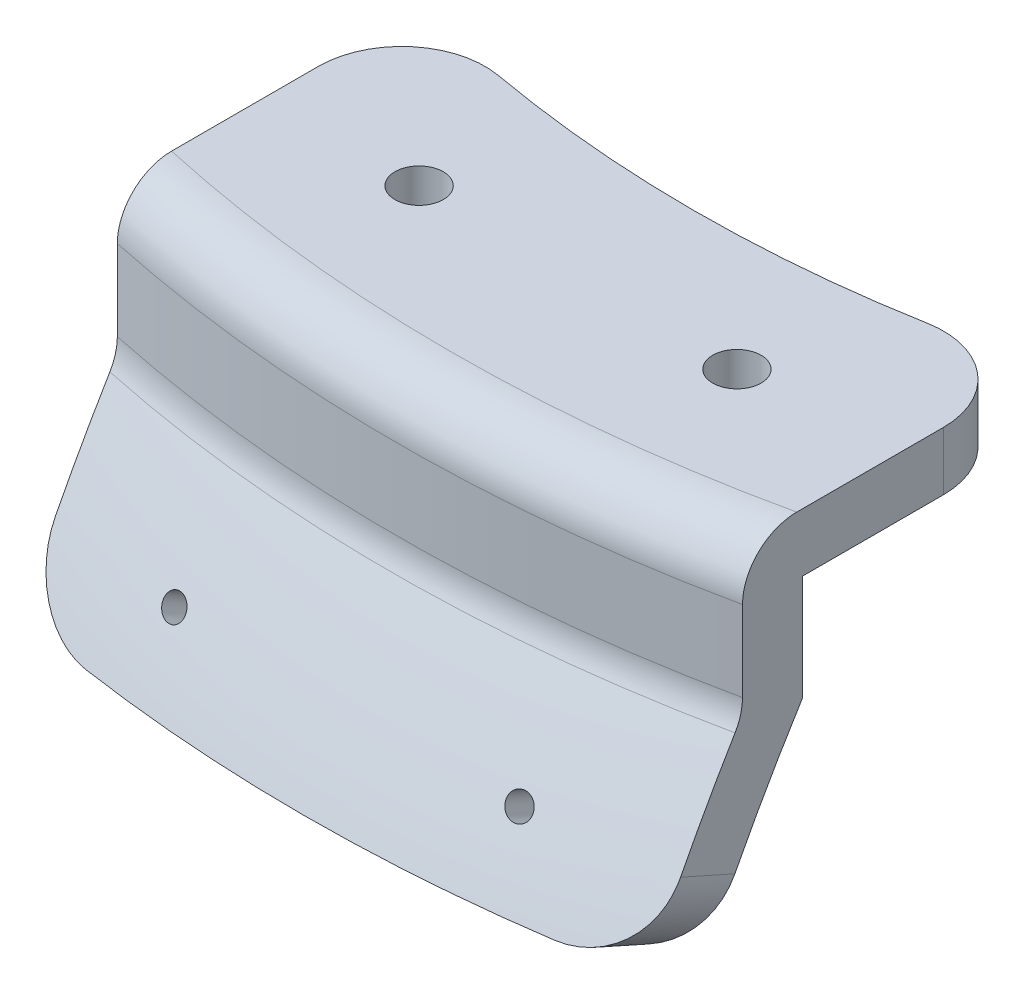
from build123d import *

# Parameters (mm, degrees)
REVOLVE1_ANGLE      = 30
FILLET1_R           = 6.35
SKETCH3_R           = 2.9
CUT_EXTRUDE1_DEPTH  = 203.397131237
SKETCH4_OUTSIDE_W   = 125.116
SKETCH4_OUTSIDE_H   = 77.698
SKETCH4_OUTSIDE_W_2 = 74.947346354
SKETCH4_OUTSIDE_H_2 = 51.780385927
CUT_EXTRUDE2_DEPTH  = 203.397131237
FILLET2_R           = 10


with BuildPart() as part:
    # Sketch2 → Revolve1 (revolve, symmetric)
    with BuildSketch(Plane(origin=(0, 0, 0), x_dir=(0, 0, -1), z_dir=(1, 0, 0))) as revolve1_sk:
        with BuildLine():
            Line((-173.362154908, 178.868849687), (-173.362154908, 166.168849687))
            ThreePointArc((-173.362154908, 166.168849687), (-179.65986055, 155.104357922), (-185.252314728, 143.667202217))
            Line((-185.252314728, 143.667202217), (-191.634038168, 146.54358987))
            ThreePointArc((-191.634038168, 146.54358987), (-186.310738836, 157.495769138), (-180.362154908, 168.121308924))
            Line((-180.362154908, 168.121308924), (-180.362154908, 185.868849687))
            Line((-180.362154908, 185.868849687), (-144.787154908, 185.868849687))
            Line((-144.787154908, 185.868849687), (-144.787154908, 178.868849687))
            Line((-144.787154908, 178.868849687), (-173.362154908, 178.868849687))
        make_face()
    revolve(axis=Axis((0, 60.169777778, 0), (0, 1, 0)), revolution_arc=REVOLVE1_ANGLE / 2)
    revolve(revolve1_sk.sketch, axis=Axis((0, 60.169777778, 0), (0, -1, 0)), revolution_arc=REVOLVE1_ANGLE / 2)

    # Fillet1
    fillet1_edges = [part.edges().sort_by_distance(p)[0] for p in [
        (0, 168.121308924, 180.362154908),
        (0, 185.868849687, 180.362154908),
    ]]
    fillet(fillet1_edges, radius=FILLET1_R)

    # Sketch3 → Cut-Extrude1 (cut, through all)
    with BuildSketch(Plane.XZ.offset(-185.868849687)):
        with Locations((19.05, 158.674245572)):
            Circle(SKETCH3_R)
        with Locations((-19.05, 158.674245572)):
            Circle(SKETCH3_R)
    extrude(amount=CUT_EXTRUDE1_DEPTH, mode=Mode.SUBTRACT)

    # Sketch4 outside → Cut-Extrude2 (cut, through all)
    with BuildSketch(Plane(origin=(0, 185.868849687, 0), x_dir=(1, 0, 0), z_dir=(0, 1, 0))):
        with Locations((0, -165.744)):
            Rectangle(SKETCH4_OUTSIDE_W, SKETCH4_OUTSIDE_H)
        with Locations((0, -165.743845205)):
            Rectangle(SKETCH4_OUTSIDE_W_2, SKETCH4_OUTSIDE_H_2, mode=Mode.SUBTRACT)
    extrude(amount=-CUT_EXTRUDE2_DEPTH, mode=Mode.SUBTRACT)

    # Fillet2
    fillet2_edges = [part.edges().sort_by_distance(p)[0] for p in [
        (-37.473673177, 145.104976424, 184.678649796),
        (-37.473673177, 182.368849687, 139.853652241),
        (37.473673177, 182.368849687, 139.853652241),
        (37.473673177, 145.104976424, 184.678649796),
    ]]
    fillet(fillet2_edges, radius=FILLET2_R)

    # Sketch6 → Cut-Revolve1 (revolve, cut)
    with BuildSketch(Plane(origin=(0, 47.768342895, -24.339186385), x_dir=(0, 0.45399049973954464, 0.891006524188369), z_dir=(0, 0.8910065241883689, -0.4539904997395446))):
        Polygon((203.466652019, 17.801025457), (275.794196508, 24.128865661), (275.663462894, 25.623157708), (203.335918404, 19.295317504), align=None)
    cut_revolve1 = revolve(axis=Axis((17.801025457, 140.140269925, 156.950928018), (0.08715574274765782, 0.4522629288245562, 0.8876159753616079)), mode=Mode.SUBTRACT)

    # Mirror1: Cut-Revolve1 across plane
    add(cut_revolve1.mirror(Plane(origin=(0, 0, 0), x_dir=(0, 0, 1), z_dir=(1, 0, 0))), mode=Mode.SUBTRACT)


solid = part.part
